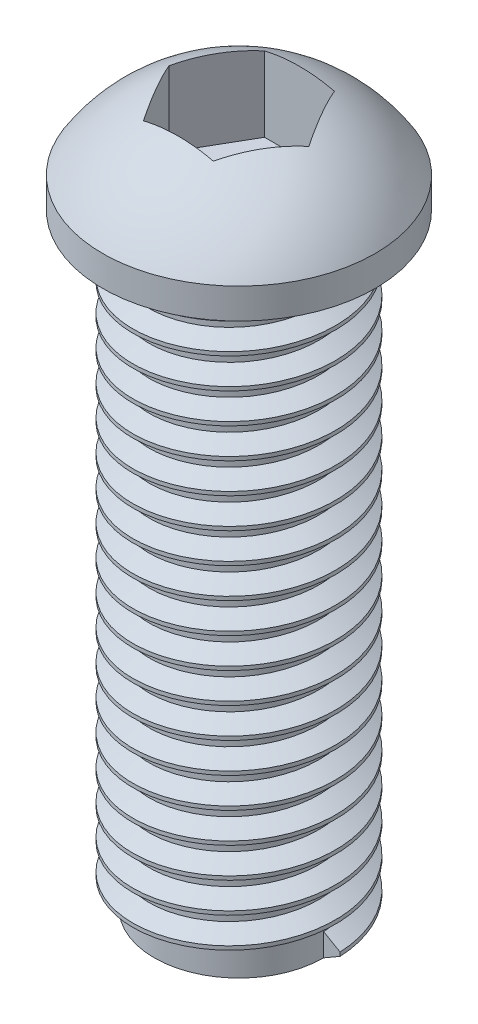
from build123d import *

# Parameters (mm, degrees)
SKETCH1_R           = 1.4
BOSS_EXTRUDE1_DEPTH = 10
CUT_EXTRUDE1_START  = 1.75
CUT_EXTRUDE1_DEPTH  = 1.5
THREAD2_PITCH       = 0.5


with BuildPart() as part:
    # Sketch1 → Boss-Extrude1 (new body)
    with BuildSketch(Plane(origin=(0, 0, 0), x_dir=(1, 0, 0), z_dir=(0, 1, 0))):
        with Locations(Location((0, 0, 0), (0, 0, 270))):
            Circle(SKETCH1_R)
    extrude(amount=-BOSS_EXTRUDE1_DEPTH)

    # Sketch2 → Revolve1 (revolve)
    with BuildSketch(Plane.XY):
        with BuildLine():
            Line((0, 0), (2.25, 0))
            Line((2.25, 0), (2.25, 0.5))
            ThreePointArc((2.25, 0.5), (1.286953768, 1.416516782), (0, 1.75))
            Line((0, 1.75), (0, 0))
        make_face()
    revolve(axis=Axis((0, 0, 0), (0, 1, 0)))

    # Sketch3 → Cut-Extrude1 (cut)
    with BuildSketch(Plane(origin=(0, 0, 0), x_dir=(1, 0, 0), z_dir=(0, 1, 0)).offset(CUT_EXTRUDE1_START)):
        Polygon((1.154700538, 0), (0.577350269, 1), (-0.577350269, 1), (-1.154700538, 0), (-0.577350269, -1), (0.577350269, -1), align=None)
    extrude(amount=-CUT_EXTRUDE1_DEPTH, mode=Mode.SUBTRACT)

    # Thread2: the profile of Thread Profile2 profile screwed along a right-hand helix of 20 turns, 6 arcs to a turn; built about Z, then put on its axis
    thread2_z = Axis((0, 0, 0), (0, 0, 1))
    thread2_corners = [(1.3997, 0, -0.000173205), (1.670632937, 0, 0.156249999), (1.670632937, 0, 0.218749999), (1.3997, 0, 0.375173204)]
    with BuildLine(mode=Mode.PRIVATE) as thread2_profile:
        Line(thread2_corners[0], thread2_corners[1])
        Line(thread2_corners[1], thread2_corners[2])
        Line(thread2_corners[2], thread2_corners[3])
        Line(thread2_corners[3], thread2_corners[0])
    thread2_cap = Face(thread2_profile.wire())
    thread2_turn_angles = [0, 30, 60, 90, 120, 150, 180, 210, 240, 270, 300, 330, 360]
    thread2_turn_weights = [1, 0.8660254037844387, 1, 0.8660254037844387, 1, 0.8660254037844387, 1, 0.8660254037844387, 1, 0.8660254037844387, 1, 0.8660254037844387, 1]
    thread2_turn_rails = [Edge.make_bspline([Vector(p[0], p[1], 0).rotate(thread2_z, thread2_turn_angles[k]) / thread2_turn_weights[k] + Vector(0, 0, p[2] + THREAD2_PITCH * thread2_turn_angles[k] / 360) for k in range(13)], [0, 0, 0, 1, 1, 2, 2, 3, 3, 4, 4, 5, 5, 6, 6, 6], 2, thread2_turn_weights) for p in thread2_corners]
    thread2_turn_sides = [Face.make_surface_from_curves(thread2_turn_rails[p[0]], thread2_turn_rails[p[1]]) for p in [(0, 1), (1, 2), (2, 3), (3, 0)]]
    thread2 = Plane(origin=(0, -10, 0), x_dir=(1, 0, 0), z_dir=(0, 1, 0)) * Solid(Shell([*[p.moved(Location((0, 0, THREAD2_PITCH * i))) for i in range(20) for p in thread2_turn_sides], thread2_cap, thread2_cap.rotate(thread2_z, 7200).moved(Location((0, 0, THREAD2_PITCH * 7200 / 360)))]))
    add(thread2)


solid = part.part
